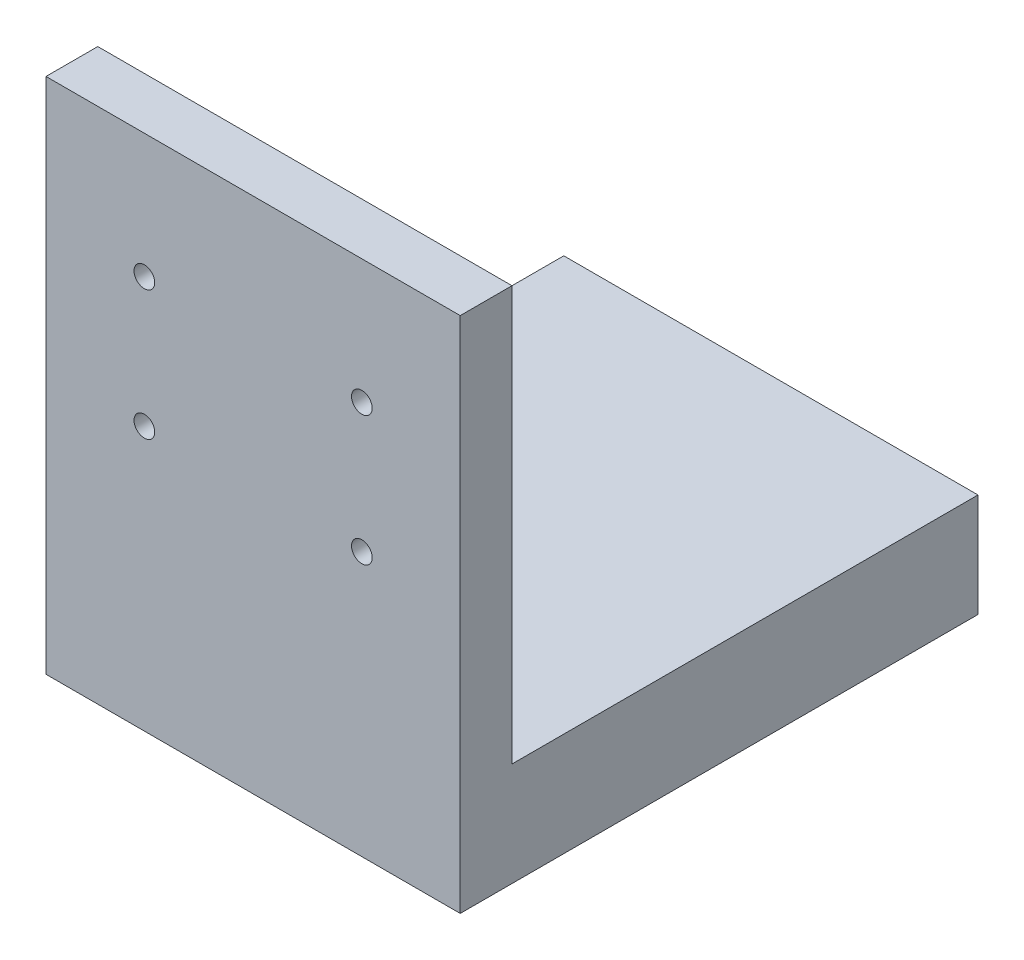
from build123d import *

# Parameters (mm, degrees)
SKETCH1_W             = 40
SKETCH1_H             = 50
BOSS_EXTRUDE1_DEPTH   = 10
SKETCH2_W             = 40
SKETCH2_H             = 5
BOSS_EXTRUDE2_DEPTH   = 40
F_2_0MM_DOWEL_HOLE1_D = 2


with BuildPart() as part:
    # Sketch1 → Boss-Extrude1 (new body)
    with BuildSketch(Plane(origin=(0, 0, 0), x_dir=(1, 0, 0), z_dir=(0, 1, 0))):
        Rectangle(SKETCH1_W, SKETCH1_H)
    extrude(amount=BOSS_EXTRUDE1_DEPTH)

    # Sketch2 → Boss-Extrude2 (add)
    with BuildSketch(Plane(origin=(0, 10, 0), x_dir=(1, 0, 0), z_dir=(0, 1, 0))):
        with Locations((0, -22.5)):
            Rectangle(SKETCH2_W, SKETCH2_H)
    extrude(amount=BOSS_EXTRUDE2_DEPTH)

    # Ø2.0mm Dowel Hole1 (through all)
    with Locations(Plane.XY.offset(25)):
        with Locations((-10.5, 38), (10.5, 38), (-10.5, 25.5), (10.5, 25.5)):
            Hole(F_2_0MM_DOWEL_HOLE1_D / 2)


solid = part.part
